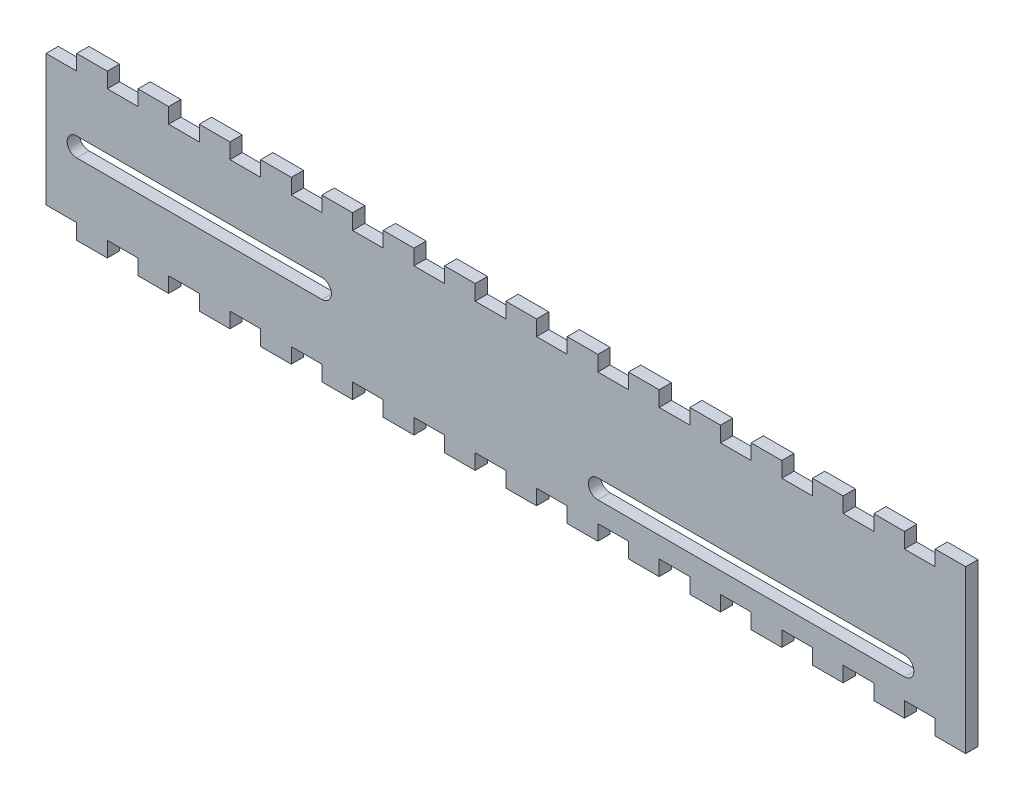
from build123d import *

# Parameters (mm, degrees)
SKETCH1_W           = 150
SKETCH1_H           = 21.4
BOSS_EXTRUDE2_DEPTH = 2
SKETCH2_W           = 5
SKETCH2_H           = 2
BOSS_EXTRUDE3_DEPTH = 2.5
LPATTERN1_COUNT     = 15
LPATTERN1_PITCH     = 10
SKETCH3_W           = 5
SKETCH3_H           = 2
BOSS_EXTRUDE4_DEPTH = 2.5
LPATTERN2_COUNT     = 15
LPATTERN2_PITCH     = 10
CUT_EXTRUDE1_DEPTH  = 10


with BuildPart() as part:
    # Sketch1 → Boss-Extrude2 (new body)
    with BuildSketch(Plane.XY):
        with Locations((75, 10.7)):
            Rectangle(SKETCH1_W, SKETCH1_H)
    extrude(amount=BOSS_EXTRUDE2_DEPTH)

    # Sketch2 → Boss-Extrude3 (add)
    with BuildSketch(Plane(origin=(0, 21.4, 0), x_dir=(1, 0, 0), z_dir=(0, 1, 0))):
        with Locations((7.5, -1)):
            Rectangle(SKETCH2_W, SKETCH2_H)
    boss_extrude3 = extrude(amount=BOSS_EXTRUDE3_DEPTH)

    # LPattern1: Boss-Extrude3 ×15
    with Locations(*[(i * LPATTERN1_PITCH, 0, 0) for i in range(1, LPATTERN1_COUNT)]):
        add(boss_extrude3)

    # Sketch3 → Boss-Extrude4 (add)
    with BuildSketch(Plane(origin=(0, 0, 0), x_dir=(-1, 0, 0), z_dir=(0, -1, 0))):
        with Locations((-7.5, -1)):
            Rectangle(SKETCH3_W, SKETCH3_H)
    boss_extrude4 = extrude(amount=BOSS_EXTRUDE4_DEPTH)

    # LPattern2: Boss-Extrude4 ×15
    with Locations(*[(i * LPATTERN2_PITCH, 0, 0) for i in range(1, LPATTERN2_COUNT)]):
        add(boss_extrude4)

    # Sketch4 → Cut-Extrude1 (cut)
    with BuildSketch(Plane(origin=(0, 0, 0), x_dir=(-1, 0, 0), z_dir=(0, 0, -1))):
        with BuildLine():
            Line((-140, 6.45), (-90, 6.45))
            ThreePointArc((-90, 6.45), (-88.45, 4.9), (-90, 3.35))
            Line((-90, 3.35), (-140, 3.35))
            ThreePointArc((-140, 3.35), (-141.55, 4.9), (-140, 6.45))
        make_face()
        with BuildLine():
            Line((-45, 12.25), (-5, 12.25))
            ThreePointArc((-5, 12.25), (-3.45, 10.7), (-5, 9.15))
            Line((-5, 9.15), (-45, 9.15))
            ThreePointArc((-45, 9.15), (-46.55, 10.7), (-45, 12.25))
        make_face()
    extrude(amount=-CUT_EXTRUDE1_DEPTH, mode=Mode.SUBTRACT)


solid = part.part
